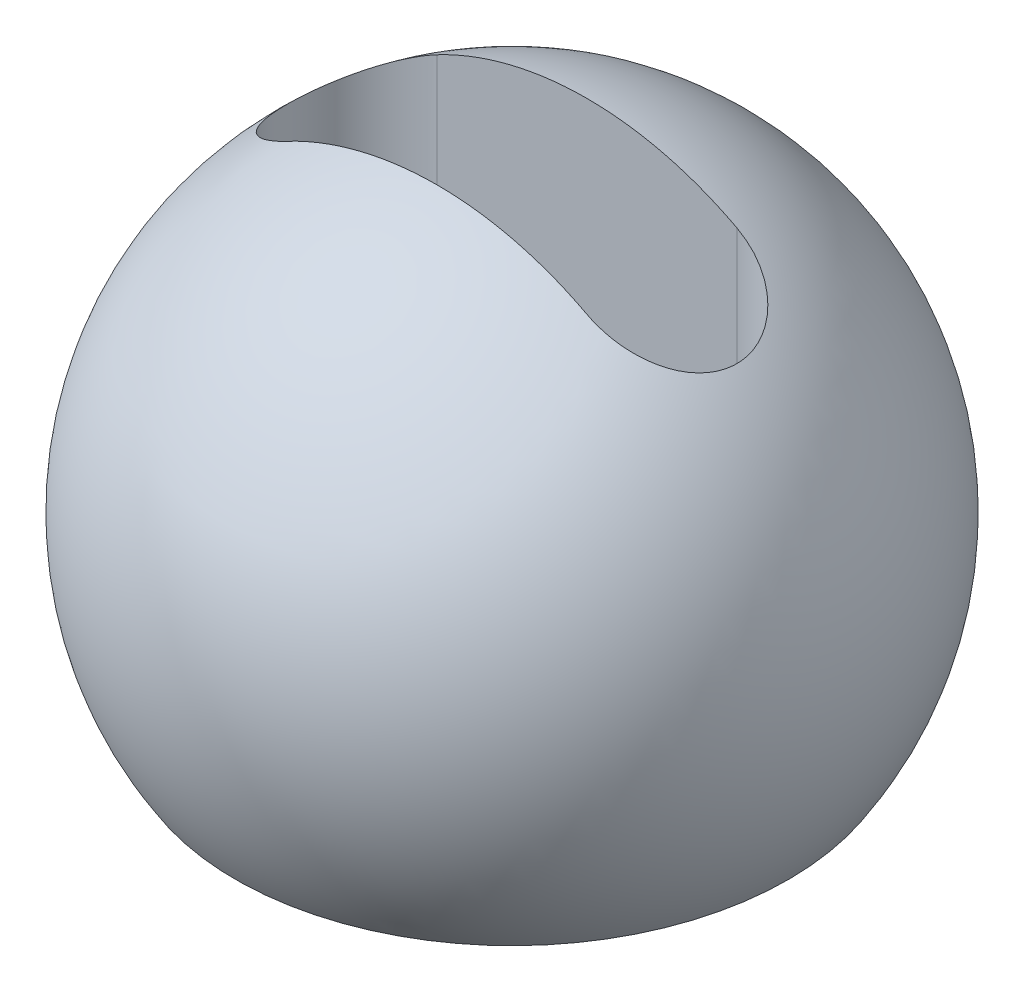
from build123d import *

# Parameters (mm, degrees)
CUT_EXTRUDE4_START = 15
CUT_EXTRUDE4_DEPTH = 80
CUT_EXTRUDE6_START = -65
SKETCH6_R          = 12.5
CUT_EXTRUDE6_DEPTH = 80


with BuildPart() as part:
    # Sketch1 → Revolve1 (revolve)
    with BuildSketch(Plane.XY):
        with BuildLine():
            Line((46.097722286, -30), (0, -30))
            Line((0, -30), (0, 55))
            ThreePointArc((0, 55), (48.347699015, 26.220221204), (46.097722286, -30))
        make_face()
    revolve(axis=Axis((0, 4.730452026, 0), (0, 1, 0)))

    # Sketch3 → Cut-Extrude4 (cut)
    with BuildSketch(Plane(origin=(0, 0, 0), x_dir=(1, 0, 0), z_dir=(0, 1, 0)).offset(CUT_EXTRUDE4_START)):
        with BuildLine():
            Line((-25, 12.5), (25, 12.5))
            ThreePointArc((25, 12.5), (37.5, 0), (25, -12.5))
            Line((25, -12.5), (-25, -12.5))
            ThreePointArc((-25, -12.5), (-37.5, 0), (-25, 12.5))
        make_face()
    extrude(amount=CUT_EXTRUDE4_DEPTH, mode=Mode.SUBTRACT)

    # Sketch6 → Cut-Extrude6 (cut)
    with BuildSketch(Plane(origin=(0, 0, 0), x_dir=(1, 0, 0), z_dir=(0, 1, 0)).offset(CUT_EXTRUDE6_START)):
        with Locations((-25, 0)):
            Circle(SKETCH6_R)
        with Locations((25, 0)):
            Circle(SKETCH6_R)
    extrude(amount=CUT_EXTRUDE6_DEPTH, mode=Mode.SUBTRACT)


solid = part.part
